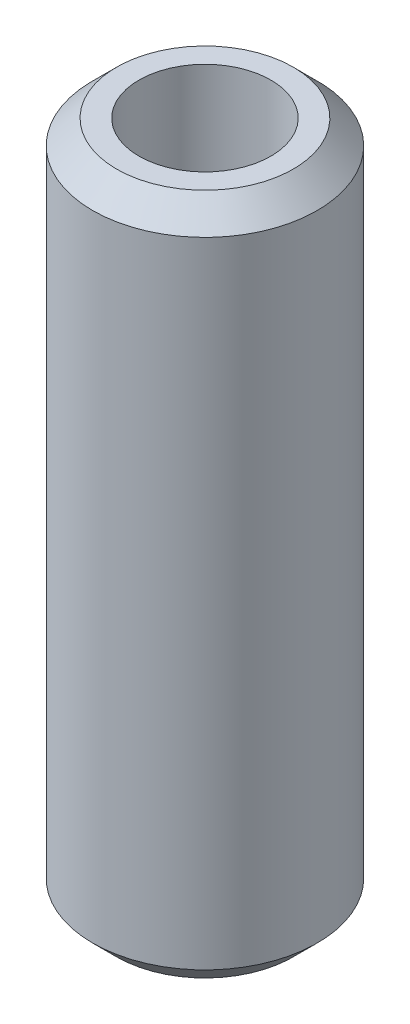
from build123d import *

# Parameters (mm, degrees)
SKETCH1_R           = 7.5
BOSS_EXTRUDE1_DEPTH = 45.572911959
SKETCH2_R           = 4.406138081
CUT_EXTRUDE1_DEPTH  = 47.790921175
CHAMFER1_SIZE       = 1.597588444


with BuildPart() as part:
    # Sketch1 → Boss-Extrude1 (new body)
    with BuildSketch(Plane(origin=(0, 0, 0), x_dir=(1, 0, 0), z_dir=(0, 1, 0))):
        Circle(SKETCH1_R)
    extrude(amount=BOSS_EXTRUDE1_DEPTH)

    # Sketch2 → Cut-Extrude1 (cut, through all)
    with BuildSketch(Plane(origin=(0, 0, 0), x_dir=(1, 0, 0), z_dir=(0, 1, 0))):
        Circle(SKETCH2_R)
    extrude(amount=CUT_EXTRUDE1_DEPTH, mode=Mode.SUBTRACT)

    # Chamfer1
    chamfer1_edges = [part.edges().sort_by_distance(p)[0] for p in [
        (-7.5, 45.572911959, 0),
        (-7.5, 0, 0),
    ]]
    chamfer(chamfer1_edges, length=CHAMFER1_SIZE)


solid = part.part
